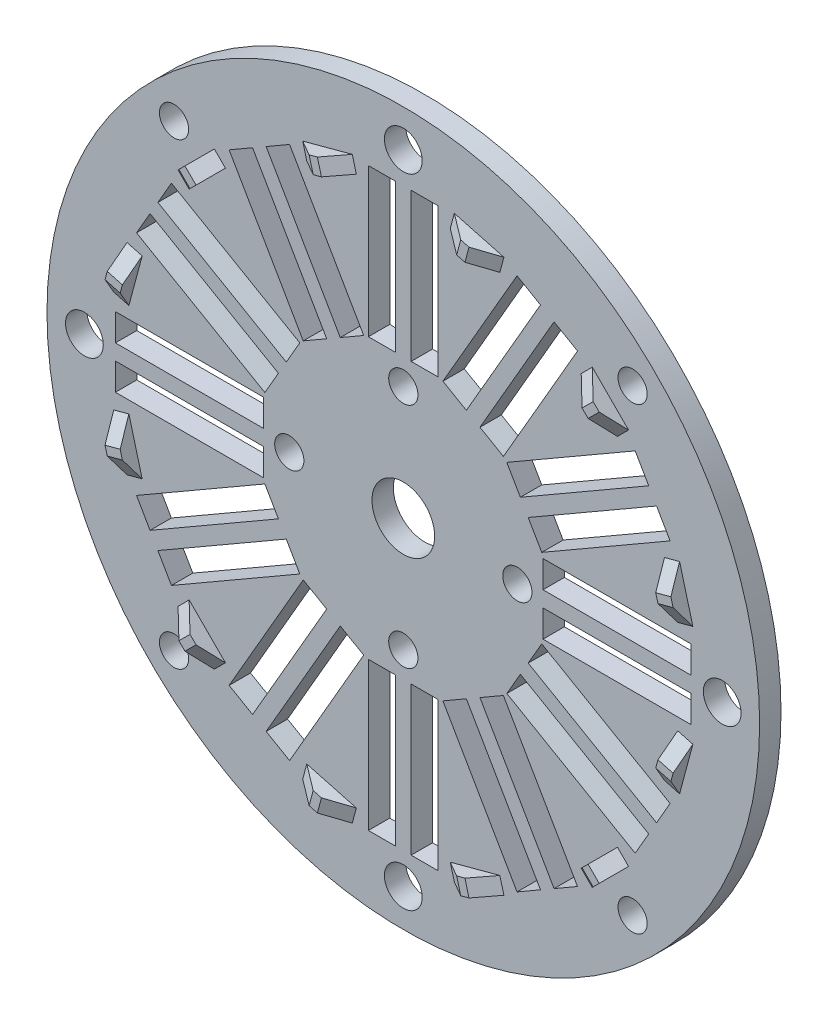
from build123d import *
from OCP.BRepFilletAPI import BRepFilletAPI_MakeChamfer

# Parameters (mm, degrees)
CROQUIS1_R              = 50
SALIENTE_EXTRUIR1_DEPTH = 3
CROQUIS2_W              = 9.8
CROQUIS2_H              = 20.8
CROQUIS2_W_2            = 20.8
CROQUIS2_H_2            = 9.8
CORTAR_EXTRUIR1_DEPTH   = 71.774289117
CROQUIS3_W              = 2.2
CROQUIS3_H              = 20.8
CROQUIS3_W_2            = 20.8
CROQUIS3_H_2            = 2.2
SALIENTE_EXTRUIR2_DEPTH = 3
CROQUIS5_R              = 4.4
CROQUIS5_R_2            = 2.65
CORTAR_EXTRUIR3_DEPTH   = 10
SALIENTE_EXTRUIR3_DEPTH = 2
CHAFL_N1_SIZE           = 2
CHAFL_N1_SIZE_2         = 3
CHAFL_N2_SIZE           = 2
CHAFL_N2_SIZE_2         = 3
CROQUIS7_R              = 2.05
CORTAR_EXTRUIR4_DEPTH   = 71.774289117


with BuildPart() as part:
    # Croquis1 → Saliente-Extruir1 (new body)
    with BuildSketch(Plane(origin=(0, 0, 0), x_dir=(0, 1, 0), z_dir=(0, 0, 1))):
        with Locations(Location((0, 0, 0), (0, 0, 270))):
            Circle(CROQUIS1_R)
    extrude(amount=SALIENTE_EXTRUIR1_DEPTH)

    # Croquis2 → Cortar-Extruir1 (cut, through all)
    with BuildSketch(Plane.XY.offset(3)):
        Polygon((15.956475521, 37.437426313), (5.556475521, 19.424097914), (14.043524479, 14.524097914), (24.443524479, 32.537426313), align=None)
        with Locations((0, 30)):
            Rectangle(CROQUIS2_W, CROQUIS2_H)
        Polygon((32.537426313, 24.443524479), (14.524097914, 14.043524479), (19.424097914, 5.556475521), (37.437426313, 15.956475521), align=None)
        with Locations((30, 0)):
            Rectangle(CROQUIS2_W_2, CROQUIS2_H_2)
        Polygon((37.437426313, -15.956475521), (19.424097914, -5.556475521), (14.524097914, -14.043524479), (32.537426313, -24.443524479), align=None)
        Polygon((24.443524479, -32.537426313), (14.043524479, -14.524097914), (5.556475521, -19.424097914), (15.956475521, -37.437426313), align=None)
        with Locations((0, -30)):
            Rectangle(CROQUIS2_W, CROQUIS2_H)
        Polygon((-15.956475521, -37.437426313), (-5.556475521, -19.424097914), (-14.043524479, -14.524097914), (-24.443524479, -32.537426313), align=None)
        Polygon((-32.537426313, -24.443524479), (-14.524097914, -14.043524479), (-19.424097914, -5.556475521), (-37.437426313, -15.956475521), align=None)
        with Locations((-30, 0)):
            Rectangle(CROQUIS2_W_2, CROQUIS2_H_2)
        Polygon((-37.437426313, 15.956475521), (-19.424097914, 5.556475521), (-14.524097914, 14.043524479), (-32.537426313, 24.443524479), align=None)
        Polygon((-24.443524479, 32.537426313), (-14.043524479, 14.524097914), (-5.556475521, 19.424097914), (-15.956475521, 37.437426313), align=None)
    extrude(amount=-CORTAR_EXTRUIR1_DEPTH, mode=Mode.SUBTRACT)

    # Croquis3 → Saliente-Extruir2 (add)
    with BuildSketch(Plane.XY.offset(3)):
        Polygon((19.247372056, 35.537426313), (8.847372056, 17.524097914), (10.752627944, 16.424097914), (21.152627944, 34.437426313), align=None)
        with Locations((0, 30)):
            Rectangle(CROQUIS3_W, CROQUIS3_H)
        Polygon((34.437426313, 21.152627944), (16.424097914, 10.752627944), (17.524097914, 8.847372056), (35.537426313, 19.247372056), align=None)
        with Locations((30, 0)):
            Rectangle(CROQUIS3_W_2, CROQUIS3_H_2)
        Polygon((35.537426313, -19.247372056), (17.524097914, -8.847372056), (16.424097914, -10.752627944), (34.437426313, -21.152627944), align=None)
        Polygon((21.152627944, -34.437426313), (10.752627944, -16.424097914), (8.847372056, -17.524097914), (19.247372056, -35.537426313), align=None)
        with Locations((0, -30)):
            Rectangle(CROQUIS3_W, CROQUIS3_H)
        Polygon((-19.247372056, -35.537426313), (-8.847372056, -17.524097914), (-10.752627944, -16.424097914), (-21.152627944, -34.437426313), align=None)
        Polygon((-34.437426313, -21.152627944), (-16.424097914, -10.752627944), (-17.524097914, -8.847372056), (-35.537426313, -19.247372056), align=None)
        with Locations((-30, 0)):
            Rectangle(CROQUIS3_W_2, CROQUIS3_H_2)
        Polygon((-35.537426313, 19.247372056), (-17.524097914, 8.847372056), (-16.424097914, 10.752627944), (-34.437426313, 21.152627944), align=None)
        Polygon((-21.152627944, 34.437426313), (-10.752627944, 16.424097914), (-8.847372056, 17.524097914), (-19.247372056, 35.537426313), align=None)
    extrude(amount=-SALIENTE_EXTRUIR2_DEPTH)

    # Croquis5 → Cortar-Extruir3 (cut)
    with BuildSketch(Plane.XY.offset(3)):
        Circle(CROQUIS5_R)
        with Locations((0, 44.75)):
            Circle(CROQUIS5_R_2)
        with Locations((44.75, 0)):
            Circle(CROQUIS5_R_2)
        with Locations((0, -44.75)):
            Circle(CROQUIS5_R_2)
        with Locations((-44.75, 0)):
            Circle(CROQUIS5_R_2)
    extrude(amount=-CORTAR_EXTRUIR3_DEPTH, mode=Mode.SUBTRACT)

    # Croquis6 → Saliente-Extruir3 (add)
    with BuildSketch(Plane.XY.offset(3)):
        Polygon((26.516504294, 31.607673119), (31.607673119, 26.516504294), (30.0520382, 24.960869376), (24.960869376, 30.0520382), align=None)
        Polygon((38.767802898, 14.114795728), (36.64276608, 13.545393829), (38.506263205, 6.59072788), (40.631300023, 7.160129779), align=None)
        Polygon((40.631300023, -7.160129779), (38.506263205, -6.59072788), (36.64276608, -13.545393829), (38.767802898, -14.114795728), align=None)
        Polygon((31.607673119, -26.516504294), (30.0520382, -24.960869376), (24.960869376, -30.0520382), (26.516504295, -31.607673119), align=None)
        Polygon((14.114795728, -38.767802898), (13.545393829, -36.64276608), (6.59072788, -38.506263205), (7.160129779, -40.631300023), align=None)
        Polygon((-7.160129779, -40.631300023), (-6.59072788, -38.506263205), (-13.545393829, -36.64276608), (-14.114795728, -38.767802898), align=None)
        Polygon((-26.516504294, -31.607673119), (-24.960869376, -30.0520382), (-30.0520382, -24.960869376), (-31.607673119, -26.516504295), align=None)
        Polygon((-38.767802898, -14.114795728), (-36.64276608, -13.545393829), (-38.506263205, -6.59072788), (-40.631300023, -7.160129779), align=None)
        Polygon((-40.631300023, 7.160129779), (-38.506263205, 6.59072788), (-36.64276608, 13.545393829), (-38.767802898, 14.114795728), align=None)
        Polygon((-31.607673119, 26.516504294), (-30.0520382, 24.960869376), (-24.960869376, 30.0520382), (-26.516504294, 31.607673119), align=None)
        Polygon((-14.114795728, 38.767802898), (-13.545393829, 36.64276608), (-6.59072788, 38.506263205), (-7.160129779, 40.631300023), align=None)
        Polygon((7.160129779, 40.631300023), (6.59072788, 38.506263205), (13.545393829, 36.64276608), (14.114795728, 38.767802898), align=None)
    extrude(amount=SALIENTE_EXTRUIR3_DEPTH)

    # Chaflán1
    chafl_n1_edges_1 = [part.edges().sort_by_distance(p)[0] for p in [
        (6.875428829, -39.568781614, 5),
    ]]
    chafl_n1_side_1 = [part.faces().sort_by_distance(p)[0] for p in [
        (6.875428829, -39.568781614, 4.96),
    ]]
    chafl_n1_edges_2 = [part.edges().sort_by_distance(p)[0] for p in [
        (-30.82985566, -25.738686835, 5),
    ]]
    chafl_n1_side_2 = [part.faces().sort_by_distance(p)[0] for p in [
        (-30.82985566, -25.738686835, 4.96),
    ]]
    chafl_n1_edges_3 = [part.edges().sort_by_distance(p)[0] for p in [
        (-13.830094779, -37.705284489, 5),
    ]]
    chafl_n1_side_3 = [part.faces().sort_by_distance(p)[0] for p in [
        (-13.830094779, -37.705284489, 4.96),
    ]]
    chafl_n1_edges_4 = [part.edges().sort_by_distance(p)[0] for p in [
        (25.738686835, -30.82985566, 5),
    ]]
    chafl_n1_side_4 = [part.faces().sort_by_distance(p)[0] for p in [
        (25.738686835, -30.82985566, 4.96),
    ]]
    chafl_n1_edges_5 = [part.edges().sort_by_distance(p)[0] for p in [
        (37.705284489, -13.830094779, 5),
    ]]
    chafl_n1_side_5 = [part.faces().sort_by_distance(p)[0] for p in [
        (37.705284489, -13.830094779, 4.96),
    ]]
    chafl_n1_edges_6 = [part.edges().sort_by_distance(p)[0] for p in [
        (39.568781614, 6.875428829, 5),
    ]]
    chafl_n1_side_6 = [part.faces().sort_by_distance(p)[0] for p in [
        (39.568781614, 6.875428829, 4.96),
    ]]
    chafl_n1_edges_7 = [part.edges().sort_by_distance(p)[0] for p in [
        (-39.568781614, -6.875428829, 5),
    ]]
    chafl_n1_side_7 = [part.faces().sort_by_distance(p)[0] for p in [
        (-39.568781614, -6.875428829, 4.96),
    ]]
    chafl_n1_edges_8 = [part.edges().sort_by_distance(p)[0] for p in [
        (-37.705284489, 13.830094779, 5),
    ]]
    chafl_n1_side_8 = [part.faces().sort_by_distance(p)[0] for p in [
        (-37.705284489, 13.830094779, 4.96),
    ]]
    chafl_n1_edges_9 = [part.edges().sort_by_distance(p)[0] for p in [
        (-25.738686835, 30.82985566, 5),
    ]]
    chafl_n1_side_9 = [part.faces().sort_by_distance(p)[0] for p in [
        (-25.738686835, 30.82985566, 4.96),
    ]]
    chafl_n1_edges_10 = [part.edges().sort_by_distance(p)[0] for p in [
        (-6.875428829, 39.568781614, 5),
    ]]
    chafl_n1_side_10 = [part.faces().sort_by_distance(p)[0] for p in [
        (-6.875428829, 39.568781614, 4.96),
    ]]
    chafl_n1_edges_11 = [part.edges().sort_by_distance(p)[0] for p in [
        (13.830094779, 37.705284489, 5),
    ]]
    chafl_n1_side_11 = [part.faces().sort_by_distance(p)[0] for p in [
        (13.830094779, 37.705284489, 4.96),
    ]]
    chafl_n1_edges_12 = [part.edges().sort_by_distance(p)[0] for p in [
        (30.82985566, 25.738686835, 5),
    ]]
    chafl_n1_side_12 = [part.faces().sort_by_distance(p)[0] for p in [
        (30.82985566, 25.738686835, 4.96),
    ]]
    chafl_n1 = BRepFilletAPI_MakeChamfer(part.part.solid().wrapped)
    for e in chafl_n1_edges_1:
        chafl_n1.Add(CHAFL_N1_SIZE - 0.0001, CHAFL_N1_SIZE_2 - 0.0001, e.wrapped, chafl_n1_side_1[0].wrapped)
    for e in chafl_n1_edges_2:
        chafl_n1.Add(CHAFL_N1_SIZE - 0.0001, CHAFL_N1_SIZE_2 - 0.0001, e.wrapped, chafl_n1_side_2[0].wrapped)
    for e in chafl_n1_edges_3:
        chafl_n1.Add(CHAFL_N1_SIZE - 0.0001, CHAFL_N1_SIZE_2 - 0.0001, e.wrapped, chafl_n1_side_3[0].wrapped)
    for e in chafl_n1_edges_4:
        chafl_n1.Add(CHAFL_N1_SIZE - 0.0001, CHAFL_N1_SIZE_2 - 0.0001, e.wrapped, chafl_n1_side_4[0].wrapped)
    for e in chafl_n1_edges_5:
        chafl_n1.Add(CHAFL_N1_SIZE - 0.0001, CHAFL_N1_SIZE_2 - 0.0001, e.wrapped, chafl_n1_side_5[0].wrapped)
    for e in chafl_n1_edges_6:
        chafl_n1.Add(CHAFL_N1_SIZE - 0.0001, CHAFL_N1_SIZE_2 - 0.0001, e.wrapped, chafl_n1_side_6[0].wrapped)
    for e in chafl_n1_edges_7:
        chafl_n1.Add(CHAFL_N1_SIZE - 0.0001, CHAFL_N1_SIZE_2 - 0.0001, e.wrapped, chafl_n1_side_7[0].wrapped)
    for e in chafl_n1_edges_8:
        chafl_n1.Add(CHAFL_N1_SIZE - 0.0001, CHAFL_N1_SIZE_2 - 0.0001, e.wrapped, chafl_n1_side_8[0].wrapped)
    for e in chafl_n1_edges_9:
        chafl_n1.Add(CHAFL_N1_SIZE - 0.0001, CHAFL_N1_SIZE_2 - 0.0001, e.wrapped, chafl_n1_side_9[0].wrapped)
    for e in chafl_n1_edges_10:
        chafl_n1.Add(CHAFL_N1_SIZE - 0.0001, CHAFL_N1_SIZE_2 - 0.0001, e.wrapped, chafl_n1_side_10[0].wrapped)
    for e in chafl_n1_edges_11:
        chafl_n1.Add(CHAFL_N1_SIZE - 0.0001, CHAFL_N1_SIZE_2 - 0.0001, e.wrapped, chafl_n1_side_11[0].wrapped)
    for e in chafl_n1_edges_12:
        chafl_n1.Add(CHAFL_N1_SIZE - 0.0001, CHAFL_N1_SIZE_2 - 0.0001, e.wrapped, chafl_n1_side_12[0].wrapped)
    add(Compound.cast(chafl_n1.Shape()), mode=Mode.REPLACE)  # a hair under: the kernel refuses the full size

    # Chaflán2
    chafl_n2_edges_1 = [part.edges().sort_by_distance(p)[0] for p in [
        (-37.705284489, -13.830094779, 5),
    ]]
    chafl_n2_side_1 = [part.faces().sort_by_distance(p)[0] for p in [
        (-37.705284489, -13.830094779, 4.96),
    ]]
    chafl_n2_edges_2 = [part.edges().sort_by_distance(p)[0] for p in [
        (-25.738686835, -30.82985566, 5),
    ]]
    chafl_n2_side_2 = [part.faces().sort_by_distance(p)[0] for p in [
        (-25.738686835, -30.82985566, 4.96),
    ]]
    chafl_n2_edges_3 = [part.edges().sort_by_distance(p)[0] for p in [
        (-6.875428829, -39.568781614, 5),
    ]]
    chafl_n2_side_3 = [part.faces().sort_by_distance(p)[0] for p in [
        (-6.875428829, -39.568781614, 4.96),
    ]]
    chafl_n2_edges_4 = [part.edges().sort_by_distance(p)[0] for p in [
        (13.830094779, -37.705284489, 5),
    ]]
    chafl_n2_side_4 = [part.faces().sort_by_distance(p)[0] for p in [
        (13.830094779, -37.705284489, 4.96),
    ]]
    chafl_n2_edges_5 = [part.edges().sort_by_distance(p)[0] for p in [
        (30.82985566, -25.738686835, 5),
    ]]
    chafl_n2_side_5 = [part.faces().sort_by_distance(p)[0] for p in [
        (30.801571388, -25.766971106, 5),
    ]]
    chafl_n2_edges_6 = [part.edges().sort_by_distance(p)[0] for p in [
        (39.568781614, -6.875428829, 5),
    ]]
    chafl_n2_side_6 = [part.faces().sort_by_distance(p)[0] for p in [
        (39.568781614, -6.875428829, 4.96),
    ]]
    chafl_n2_edges_7 = [part.edges().sort_by_distance(p)[0] for p in [
        (-39.568781614, 6.875428829, 5),
    ]]
    chafl_n2_side_7 = [part.faces().sort_by_distance(p)[0] for p in [
        (-39.568781614, 6.875428829, 4.96),
    ]]
    chafl_n2_edges_8 = [part.edges().sort_by_distance(p)[0] for p in [
        (37.705284489, 13.830094779, 5),
    ]]
    chafl_n2_side_8 = [part.faces().sort_by_distance(p)[0] for p in [
        (37.705284489, 13.830094779, 4.96),
    ]]
    chafl_n2_edges_9 = [part.edges().sort_by_distance(p)[0] for p in [
        (25.738686835, 30.82985566, 5),
    ]]
    chafl_n2_side_9 = [part.faces().sort_by_distance(p)[0] for p in [
        (25.738686835, 30.82985566, 4.96),
    ]]
    chafl_n2_edges_10 = [part.edges().sort_by_distance(p)[0] for p in [
        (6.875428829, 39.568781614, 5),
    ]]
    chafl_n2_side_10 = [part.faces().sort_by_distance(p)[0] for p in [
        (6.875428829, 39.568781614, 4.96),
    ]]
    chafl_n2_edges_11 = [part.edges().sort_by_distance(p)[0] for p in [
        (-13.830094779, 37.705284489, 5),
    ]]
    chafl_n2_side_11 = [part.faces().sort_by_distance(p)[0] for p in [
        (-13.830094779, 37.705284489, 4.96),
    ]]
    chafl_n2_edges_12 = [part.edges().sort_by_distance(p)[0] for p in [
        (-30.82985566, 25.738686835, 5),
    ]]
    chafl_n2_side_12 = [part.faces().sort_by_distance(p)[0] for p in [
        (-30.82985566, 25.738686835, 4.96),
    ]]
    chafl_n2 = BRepFilletAPI_MakeChamfer(part.part.solid().wrapped)
    for e in chafl_n2_edges_1:
        chafl_n2.Add(CHAFL_N2_SIZE - 0.0001, CHAFL_N2_SIZE_2 - 0.0001, e.wrapped, chafl_n2_side_1[0].wrapped)
    for e in chafl_n2_edges_2:
        chafl_n2.Add(CHAFL_N2_SIZE - 0.0001, CHAFL_N2_SIZE_2 - 0.0001, e.wrapped, chafl_n2_side_2[0].wrapped)
    for e in chafl_n2_edges_3:
        chafl_n2.Add(CHAFL_N2_SIZE - 0.0001, CHAFL_N2_SIZE_2 - 0.0001, e.wrapped, chafl_n2_side_3[0].wrapped)
    for e in chafl_n2_edges_4:
        chafl_n2.Add(CHAFL_N2_SIZE - 0.0001, CHAFL_N2_SIZE_2 - 0.0001, e.wrapped, chafl_n2_side_4[0].wrapped)
    for e in chafl_n2_edges_5:
        chafl_n2.Add(CHAFL_N2_SIZE_2 - 0.0001, CHAFL_N2_SIZE - 0.0001, e.wrapped, chafl_n2_side_5[0].wrapped)
    for e in chafl_n2_edges_6:
        chafl_n2.Add(CHAFL_N2_SIZE - 0.0001, CHAFL_N2_SIZE_2 - 0.0001, e.wrapped, chafl_n2_side_6[0].wrapped)
    for e in chafl_n2_edges_7:
        chafl_n2.Add(CHAFL_N2_SIZE - 0.0001, CHAFL_N2_SIZE_2 - 0.0001, e.wrapped, chafl_n2_side_7[0].wrapped)
    for e in chafl_n2_edges_8:
        chafl_n2.Add(CHAFL_N2_SIZE - 0.0001, CHAFL_N2_SIZE_2 - 0.0001, e.wrapped, chafl_n2_side_8[0].wrapped)
    for e in chafl_n2_edges_9:
        chafl_n2.Add(CHAFL_N2_SIZE - 0.0001, CHAFL_N2_SIZE_2 - 0.0001, e.wrapped, chafl_n2_side_9[0].wrapped)
    for e in chafl_n2_edges_10:
        chafl_n2.Add(CHAFL_N2_SIZE - 0.0001, CHAFL_N2_SIZE_2 - 0.0001, e.wrapped, chafl_n2_side_10[0].wrapped)
    for e in chafl_n2_edges_11:
        chafl_n2.Add(CHAFL_N2_SIZE - 0.0001, CHAFL_N2_SIZE_2 - 0.0001, e.wrapped, chafl_n2_side_11[0].wrapped)
    for e in chafl_n2_edges_12:
        chafl_n2.Add(CHAFL_N2_SIZE - 0.0001, CHAFL_N2_SIZE_2 - 0.0001, e.wrapped, chafl_n2_side_12[0].wrapped)
    add(Compound.cast(chafl_n2.Shape()), mode=Mode.REPLACE)  # a hair under: the kernel refuses the full size

    # Croquis7 → Cortar-Extruir4 (cut, through all)
    with BuildSketch(Plane.XY.offset(3)):
        with Locations((0, 16)):
            Circle(CROQUIS7_R)
        with Locations((16, 0)):
            Circle(CROQUIS7_R)
        with Locations((0, -16)):
            Circle(CROQUIS7_R)
        with Locations((-16, 0)):
            Circle(CROQUIS7_R)
        with Locations((-32.173358544, 32.173358544)):
            Circle(CROQUIS7_R)
        with Locations((32.173358544, 32.173358544)):
            Circle(CROQUIS7_R)
        with Locations((32.173358544, -32.173358544)):
            Circle(CROQUIS7_R)
        with Locations((-32.173358544, -32.173358544)):
            Circle(CROQUIS7_R)
    extrude(amount=-CORTAR_EXTRUIR4_DEPTH, mode=Mode.SUBTRACT)


solid = part.part
